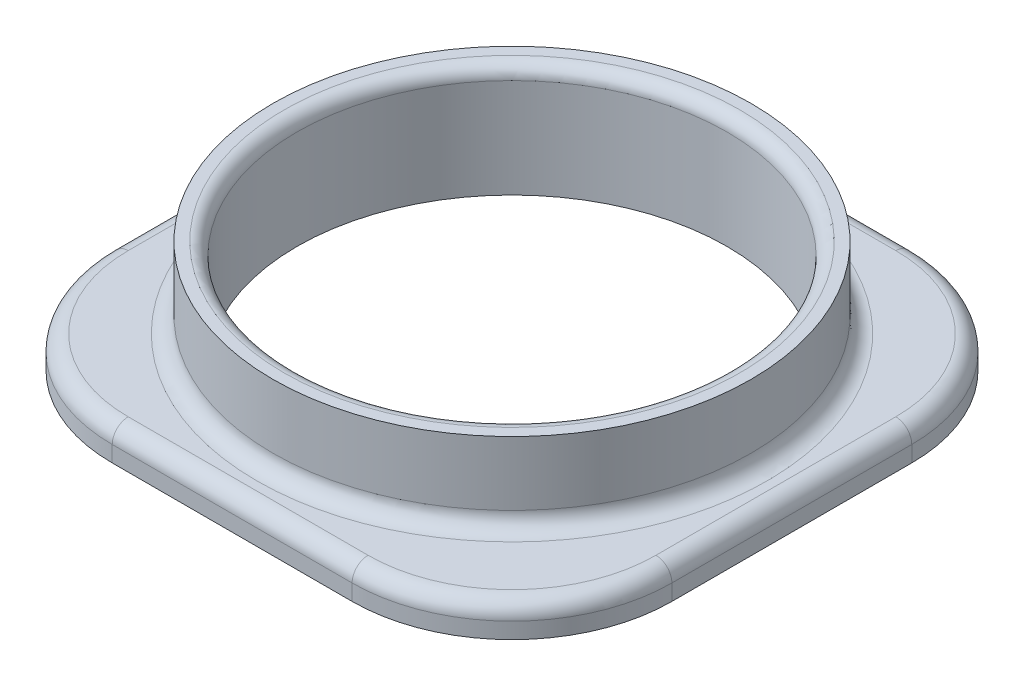
from build123d import *

# Parameters (mm, degrees)
SKETCH1_R           = 14.95
SKETCH1_R_2         = 13.45
BOSS_EXTRUDE1_DEPTH = 5
BOSS_EXTRUDE2_START = 2
SKETCH2_R           = 13.45
BOSS_EXTRUDE2_DEPTH = 2
FILLET1_R           = 0.8
FILLET4_R           = 1


with BuildPart() as part:
    # Sketch1 → Boss-Extrude1 (new body)
    with BuildSketch(Plane(origin=(0, 0, 0), x_dir=(1, 0, 0), z_dir=(0, 1, 0))):
        Circle(SKETCH1_R)
        Circle(SKETCH1_R_2, mode=Mode.SUBTRACT)
    extrude(amount=BOSS_EXTRUDE1_DEPTH)

    # Sketch2 → Boss-Extrude2 (add)
    with BuildSketch(Plane.XZ.offset(BOSS_EXTRUDE2_START)):
        with BuildLine():
            Line((-7.5, -17.5), (7.5, -17.5))
            ThreePointArc((7.5, -17.5), (14.571067812, -14.571067812), (17.5, -7.5))
            Line((17.5, -7.5), (17.5, 7.5))
            ThreePointArc((17.5, 7.5), (14.571067812, 14.571067812), (7.5, 17.5))
            Line((7.5, 17.5), (-7.5, 17.5))
            ThreePointArc((-7.5, 17.5), (-14.571067812, 14.571067812), (-17.5, 7.5))
            Line((-17.5, 7.5), (-17.5, -7.5))
            ThreePointArc((-17.5, -7.5), (-14.571067812, -14.571067812), (-7.5, -17.5))
        make_face()
        Circle(SKETCH2_R, mode=Mode.SUBTRACT)
    extrude(amount=-BOSS_EXTRUDE2_DEPTH)

    # Fillet1
    fillet1_edges = [part.edges().sort_by_distance(p)[0] for p in [
        (-13.45, 5, 0),
    ]]
    fillet(fillet1_edges, radius=FILLET1_R)

    # Fillet4
    fillet4_edges = [part.edges().sort_by_distance(p)[0] for p in [
        (0, 0, -17.5),
        (14.571067812, 0, -14.571067812),
        (17.5, 0, 0),
        (14.571067812, 0, 14.571067812),
        (0, 0, 17.5),
        (-14.571067812, 0, 14.571067812),
        (-17.5, 0, 0),
        (-14.571067812, 0, -14.571067812),
        (-14.95, 0, 0),
    ]]
    fillet(fillet4_edges, radius=FILLET4_R)


solid = part.part
